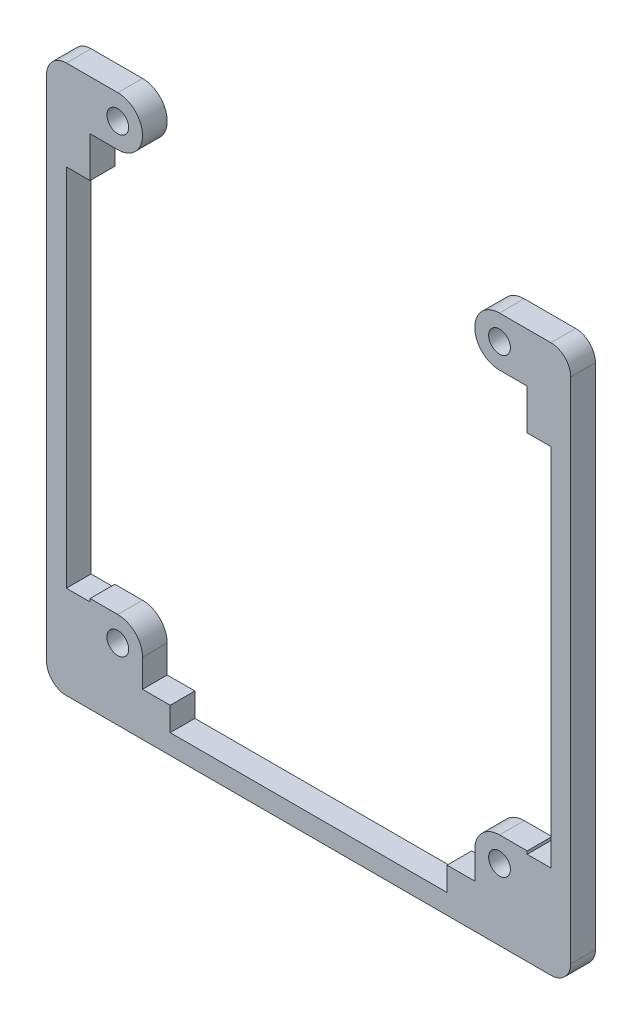
from build123d import *

# Parameters (mm, degrees)
SKETCH1_R           = 1.397
BOSS_EXTRUDE1_DEPTH = 3.175


with BuildPart() as part:
    # Sketch1 → Boss-Extrude1 (new body)
    with BuildSketch(Plane.XY):
        with BuildLine():
            Line((0, 58.42), (0, 53.213))
            Line((0, 53.213), (3.048, 53.213))
            Line((3.048, 53.213), (3.048, 6.35))
            Line((3.048, 6.35), (0, 6.35))
            Line((0, 6.35), (0, 6.731))
            Line((0, 6.731), (-3.556, 6.731))
            ThreePointArc((-3.556, 6.731), (-5.80106403, 5.80106403), (-6.731, 3.556))
            Line((-6.731, 3.556), (-6.731, 0))
            Line((-6.731, 0), (-10.287, 0))
            Line((-10.287, 0), (-10.287, -3.048))
            Line((-10.287, -3.048), (-45.847, -3.048))
            Line((-45.847, -3.048), (-45.847, 0))
            Line((-45.847, 0), (-49.403, 0))
            Line((-49.403, 0), (-49.403, 3.556))
            ThreePointArc((-49.403, 3.556), (-50.33293597, 5.80106403), (-52.578, 6.731))
            Line((-52.578, 6.731), (-56.134, 6.731))
            Line((-56.134, 6.731), (-56.134, 6.35))
            Line((-56.134, 6.35), (-59.182, 6.35))
            Line((-59.182, 6.35), (-59.182, 53.213))
            Line((-59.182, 53.213), (-56.134, 53.213))
            Line((-56.134, 53.213), (-56.134, 58.42))
            Line((-56.134, 58.42), (-52.578, 58.42))
            ThreePointArc((-52.578, 58.42), (-49.403, 61.595), (-52.578, 64.77))
            Line((-52.578, 64.77), (-59.182, 64.77))
            ThreePointArc((-59.182, 64.77), (-60.978051224, 64.026051224), (-61.722, 62.23))
            Line((-61.722, 62.23), (-61.722, -3.048))
            ThreePointArc((-61.722, -3.048), (-60.978051224, -4.844051224), (-59.182, -5.588))
            Line((-59.182, -5.588), (3.048, -5.588))
            ThreePointArc((3.048, -5.588), (4.844051224, -4.844051224), (5.588, -3.048))
            Line((5.588, -3.048), (5.588, 62.23))
            ThreePointArc((5.588, 62.23), (4.844051224, 64.026051224), (3.048, 64.77))
            Line((3.048, 64.77), (-3.556000021, 64.77))
            ThreePointArc((-3.556000021, 64.77), (-6.731, 61.59499999), (-3.556, 58.42))
            Line((-3.556, 58.42), (0, 58.42))
        make_face()
        with Locations((-3.556, 61.595)):
            Circle(SKETCH1_R, mode=Mode.SUBTRACT)
        with Locations((-52.578, 61.595)):
            Circle(SKETCH1_R, mode=Mode.SUBTRACT)
        with Locations((-52.578, 3.556)):
            Circle(SKETCH1_R, mode=Mode.SUBTRACT)
        with Locations((-3.556, 3.556)):
            Circle(SKETCH1_R, mode=Mode.SUBTRACT)
    extrude(amount=BOSS_EXTRUDE1_DEPTH)


solid = part.part
